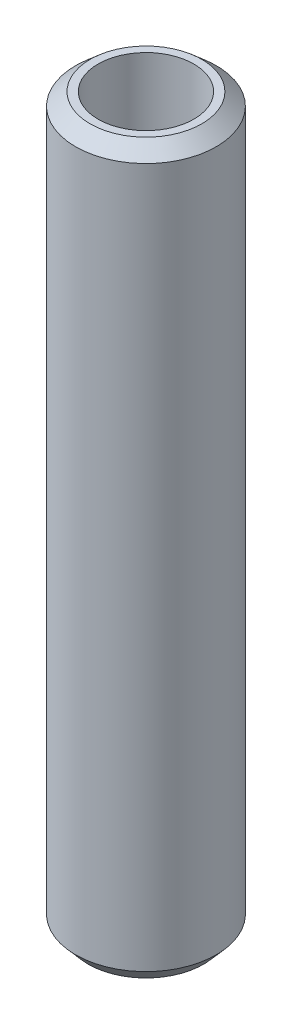
from build123d import *
from OCP.BRepFilletAPI import BRepFilletAPI_MakeChamfer

# Parameters (mm, degrees)
SKETCH1_R           = 27.5
BOSS_EXTRUDE1_DEPTH = 284.217432379
SKETCH2_R           = 18.716185221
CUT_EXTRUDE1_DEPTH  = 287.86590747
CHAMFER1_SIZE       = 4.93542871
CHAMFER1_SIZE2      = 5.660691361


with BuildPart() as part:
    # Sketch1 → Boss-Extrude1 (new body)
    with BuildSketch(Plane(origin=(0, 0, 0), x_dir=(1, 0, 0), z_dir=(0, 1, 0))):
        Circle(SKETCH1_R)
    extrude(amount=BOSS_EXTRUDE1_DEPTH)

    # Sketch2 → Cut-Extrude1 (cut, through all)
    with BuildSketch(Plane(origin=(0, 0, 0), x_dir=(1, 0, 0), z_dir=(0, 1, 0))):
        Circle(SKETCH2_R)
    extrude(amount=CUT_EXTRUDE1_DEPTH, mode=Mode.SUBTRACT)

    # Chamfer1: one chamfer whose edges measure the first distance from different faces: ONE call of the kernel's chamfer builder (chamfer() names one face for all edges)
    chamfer1_edges_1 = [part.edges().sort_by_distance(p)[0] for p in [
        (-27.5, 284.217432379, 0),
    ]]
    chamfer1_side_1 = [part.faces().sort_by_distance(p)[0] for p in [
        (-27.5, 142.10871619, 0),
    ]]
    chamfer1_edges_2 = [part.edges().sort_by_distance(p)[0] for p in [
        (-27.5, 0, 0),
    ]]
    chamfer1_side_2 = [part.faces().sort_by_distance(p)[0] for p in [
        (-26.722182541, 0, 0),
    ]]
    chamfer1 = BRepFilletAPI_MakeChamfer(part.part.solid().wrapped)
    for e in chamfer1_edges_1:
        chamfer1.Add(CHAMFER1_SIZE, CHAMFER1_SIZE2, e.wrapped, chamfer1_side_1[0].wrapped)  # the first distance lies on this face
    for e in chamfer1_edges_2:
        chamfer1.Add(CHAMFER1_SIZE, CHAMFER1_SIZE2, e.wrapped, chamfer1_side_2[0].wrapped)  # the first distance lies on this face
    add(Compound.cast(chamfer1.Shape()), mode=Mode.REPLACE)


solid = part.part
